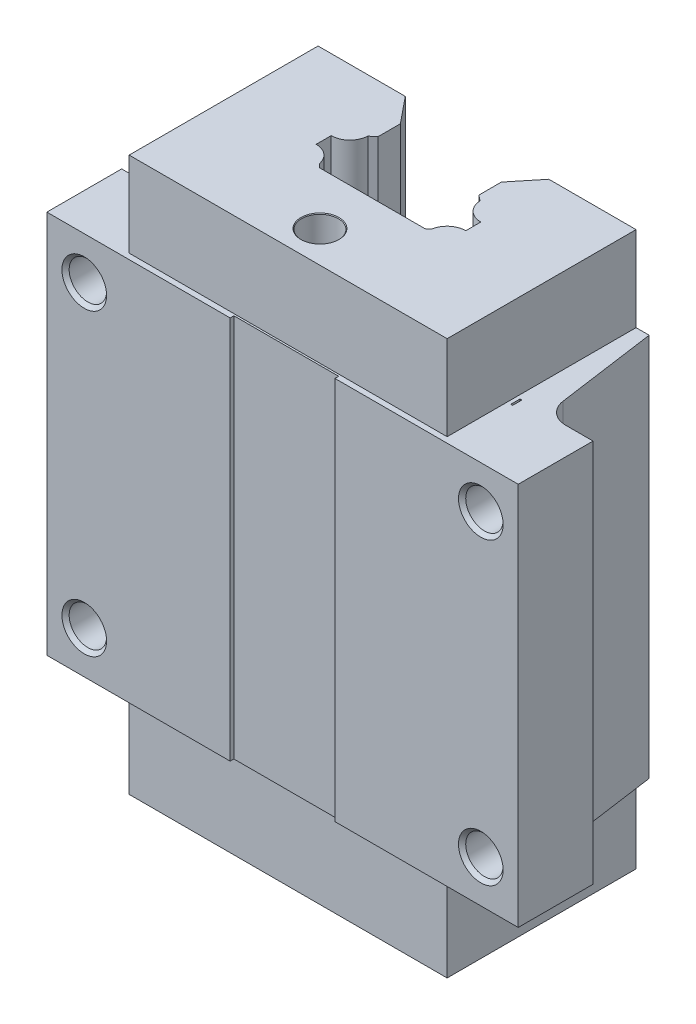
from build123d import *

# Parameters (mm, degrees)
SKIZZE1_W                       = 44
SKIZZE1_H                       = 51.3
AUFSATZ_LINEAR_AUSTRAGEN1_DEPTH = 26
SKIZZE2_W                       = 0.25
SKIZZE2_H                       = 17.25
SCHNITT_LINEAR_AUSTRAGEN1_DEPTH = 64.369472146
SKIZZE3_W                       = 14
SKIZZE3_H                       = 0.5
SCHNITT_LINEAR_AUSTRAGEN2_DEPTH = 64.369472146
SKIZZE4_W                       = 0.25
SKIZZE4_H                       = 17.25
SCHNITT_LINEAR_AUSTRAGEN3_DEPTH = 51.3
SKIZZE5_W                       = 42.5
SKIZZE5_H                       = 25.25
AUFSATZ_LINEAR_AUSTRAGEN2_DEPTH = 11.35
SKIZZE6_W                       = 42.5
SKIZZE6_H                       = 25.25
AUFSATZ_LINEAR_AUSTRAGEN3_DEPTH = 11.35
SKIZZE15_W                      = 9.5
SKIZZE15_H                      = 51.3
AUFSATZ_LINEAR_AUSTRAGEN5_DEPTH = 10
SCHNITT_LINEAR_AUSTRAGEN4_DEPTH = 86.838511171
BOHRUNG1_D                      = 4.917
BOHRUNG1_DEPTH                  = 15
BOHRUNG1_TIP                    = 1.477215832
BOHRUNG2_D                      = 4.917
BOHRUNG2_DEPTH                  = 15
BOHRUNG2_TIP                    = 1.477215832
M6_GEWINDEBOHRUNG1_D            = 5
M6_GEWINDEBOHRUNG1_DEPTH        = 17
M6_GEWINDEBOHRUNG1_TIP          = 1.502151548
FASE1_SIZE                      = 0.483
FASE2_SIZE                      = 0.448979592
FASE3_SIZE                      = 0.0915
FASE4_SIZE                      = 0.448979592
AUFSATZ_LINEAR_START            = -51.3
AUFSATZ_LINEAR_AUSTRAGEN6_DEPTH = 51.3
VERRUNDUNG1_R                   = 3


with BuildPart() as part:
    # Skizze1 → Aufsatz-Linear austragen1 (new body)
    with BuildSketch(Plane(origin=(0, 0, 4), x_dir=(-1, 0, 0), z_dir=(0, 0, -1))):
        Rectangle(SKIZZE1_W, SKIZZE1_H)
    extrude(amount=-AUFSATZ_LINEAR_AUSTRAGEN1_DEPTH)

    # Skizze2 → Schnitt-Linear austragen1 (cut, through all)
    with BuildSketch(Plane.XZ.offset(25.65)):
        with Locations((-21.875, 12.625)):
            Rectangle(SKIZZE2_W, SKIZZE2_H)
    extrude(amount=-SCHNITT_LINEAR_AUSTRAGEN1_DEPTH, mode=Mode.SUBTRACT)

    # Skizze3 → Schnitt-Linear austragen2 (cut, through all)
    with BuildSketch(Plane.XZ.offset(25.65)):
        with Locations((0, 29.75)):
            Rectangle(SKIZZE3_W, SKIZZE3_H)
    extrude(amount=-SCHNITT_LINEAR_AUSTRAGEN2_DEPTH, mode=Mode.SUBTRACT)

    # Skizze4 → Schnitt-Linear austragen3 (cut)
    with BuildSketch(Plane.XZ.offset(25.65)):
        with Locations((21.875, 12.625)):
            Rectangle(SKIZZE4_W, SKIZZE4_H)
    extrude(amount=-SCHNITT_LINEAR_AUSTRAGEN3_DEPTH, mode=Mode.SUBTRACT)

    # Skizze5 → Aufsatz-Linear austragen2 (add)
    with BuildSketch(Plane(origin=(0, 25.65, 0), x_dir=(-1, 0, 0), z_dir=(0, 1, 0))):
        with Locations((0, 16.625)):
            Rectangle(SKIZZE5_W, SKIZZE5_H)
    extrude(amount=AUFSATZ_LINEAR_AUSTRAGEN2_DEPTH)

    # Skizze6 → Aufsatz-Linear austragen3 (add)
    with BuildSketch(Plane.XZ.offset(25.65)):
        with Locations((0, 16.625)):
            Rectangle(SKIZZE6_W, SKIZZE6_H)
    extrude(amount=AUFSATZ_LINEAR_AUSTRAGEN3_DEPTH)

    # Skizze15 → Aufsatz-Linear austragen5 (add)
    with BuildSketch(Plane.XY.offset(30)):
        with Locations((-26.75, 0)):
            Rectangle(SKIZZE15_W, SKIZZE15_H)
        with Locations((26.75, 0)):
            Rectangle(SKIZZE15_W, SKIZZE15_H)
    extrude(amount=-AUFSATZ_LINEAR_AUSTRAGEN5_DEPTH)

    # Skizze7 → Schnitt-Linear austragen4 (cut, through all)
    with BuildSketch(Plane.XZ.offset(37)):
        with BuildLine():
            Line((-9.59375, 4), (9.59375, 4))
            Line((9.59375, 4), (6.75, 7.5))
            Line((6.75, 7.5), (6.75, 10.5))
            Line((6.75, 10.5), (7.5, 11.109375))
            ThreePointArc((7.5, 11.109375), (8.270470592, 12.806156162), (10, 13.5))
            Line((10, 13.5), (10, 15.5))
            ThreePointArc((10, 15.5), (8.232233047, 16.232233047), (7.5, 18))
            Line((7.5, 18), (-7.5, 18))
            ThreePointArc((-7.5, 18), (-8.232233047, 16.232233047), (-10, 15.5))
            Line((-10, 15.5), (-10, 13.5))
            ThreePointArc((-10, 13.5), (-8.270470592, 12.806156162), (-7.5, 11.109375))
            Line((-7.5, 11.109375), (-6.75, 10.5))
            Line((-6.75, 10.5), (-6.75, 7.5))
            Line((-6.75, 7.5), (-9.59375, 4))
        make_face()
    extrude(amount=-SCHNITT_LINEAR_AUSTRAGEN4_DEPTH, mode=Mode.SUBTRACT)

    # Bohrung1
    with Locations(Plane(origin=(0, -37, 0), x_dir=(-1, 0, 0), z_dir=(0, -1, 0))):
        with Locations((0, -25)):
            Hole(BOHRUNG1_D / 2, depth=BOHRUNG1_DEPTH)
            with Locations((0, 0, -(BOHRUNG1_DEPTH + BOHRUNG1_TIP / 2))):  # 118° drill point
                Cone(0, BOHRUNG1_D / 2, BOHRUNG1_TIP, mode=Mode.SUBTRACT)

    # Bohrung2
    with Locations(Plane(origin=(0, 37, 0), x_dir=(1, 0, 0), z_dir=(0, 1, 0))):
        with Locations((0, -25)):
            Hole(BOHRUNG2_D / 2, depth=BOHRUNG2_DEPTH)
            with Locations((0, 0, -(BOHRUNG2_DEPTH + BOHRUNG2_TIP / 2))):  # 118° drill point
                Cone(0, BOHRUNG2_D / 2, BOHRUNG2_TIP, mode=Mode.SUBTRACT)

    # M6 Gewindebohrung1
    with Locations(Plane.XY.offset(30)):
        with Locations((26.5, -20), (26.5, 20), (-26.5, 20), (-26.5, -20)):
            Hole(M6_GEWINDEBOHRUNG1_D / 2, depth=M6_GEWINDEBOHRUNG1_DEPTH)
            with Locations((0, 0, -(M6_GEWINDEBOHRUNG1_DEPTH + M6_GEWINDEBOHRUNG1_TIP / 2))):  # 118° drill point
                Cone(0, M6_GEWINDEBOHRUNG1_D / 2, M6_GEWINDEBOHRUNG1_TIP, mode=Mode.SUBTRACT)

    # Fase1
    fase1_edges = [part.edges().sort_by_distance(p)[0] for p in [
        (-24, -20, 30),
        (-24, 20, 30),
        (29, 20, 30),
        (29, -20, 30),
    ]]
    chamfer(fase1_edges, length=FASE1_SIZE)

    # Fase2
    # the kernel refuses this chamfer: 0.448979592, 0.406117321 mm, written as the material it adds along each edge
    with BuildSketch(Plane(origin=(-7.5, -37, 18), x_dir=(1, 0, 0), z_dir=(0, 1, 0))) as fase2_piece_1:
        with BuildLine():
            Line((FASE2_SIZE, 0), (-0.03932739, 0.441690284))
            ThreePointArc((-0.03932739, 0.441690284), (-0.010448273, 0.22832477), (0, 0))
            Line((0, 0), (FASE2_SIZE, 0))
        make_face()
    extrude(amount=74)

    # Fase3
    fase3_edges = [part.edges().sort_by_distance(p)[0] for p in [
        (-2.4585, -37, 25),
        (2.4585, 37, 25),
    ]]
    chamfer(fase3_edges, length=FASE3_SIZE)

    # Fase4
    # the kernel refuses this chamfer: 0.448979592, 0.406117321 mm, written as the material it adds along each edge
    with BuildSketch(Plane(origin=(7.5, -37, 18), x_dir=(0.08868753028202897, 0, -0.9960594972050988), z_dir=(0, 1, 0))) as fase4_piece_1:
        with BuildLine():
            Line((0.443437651, 0), (-FASE4_SIZE * 0.0886875302498, FASE4_SIZE * 0.996059496843))
            Line((-FASE4_SIZE * 0.0886875302498, FASE4_SIZE * 0.996059496843), (0, 0))
            ThreePointArc((0, 0), (0.228351687, 0.009842458), (0.443437651, 0))
        make_face()
    extrude(amount=74)

    # Skizze16 → Aufsatz-Linear austragen6 (add)
    with BuildSketch(Plane.XZ.offset(25.65).offset(AUFSATZ_LINEAR_START)):
        Polygon((-21.75, 4), (-21.75, 20), (-25.25, 20), (-23, 4), align=None)
        Polygon((21.75, 20), (25.25, 20), (23, 4), (21.75, 4), align=None)
    extrude(amount=AUFSATZ_LINEAR_AUSTRAGEN6_DEPTH)

    # Verrundung1
    # the kernel refuses this fillet: 3 mm, written as the material it adds along each edge
    with BuildSketch(Plane(origin=(-25.25, 25.65, 20), x_dir=(0.13925483139909986, 0, -0.9902565788380344), z_dir=(0, -1, 0))) as verrundung1_piece_1_section:
        with BuildLine():
            CenterArc((VERRUNDUNG1_R * 0.869214289504, -VERRUNDUNG1_R), VERRUNDUNG1_R, 90, 81.995271143)
            Line((-VERRUNDUNG1_R * 0.121042289335, -VERRUNDUNG1_R * 0.860745168601), (0, 0))
            Line((0, 0), (VERRUNDUNG1_R * 0.869214289504, 0))
        make_face()
    verrundung1_piece_1 = extrude(amount=10.004043662, mode=Mode.PRIVATE)
    verrundung1_piece_1 = verrundung1_piece_1 - Plane(origin=(-26.5, 20, 20), x_dir=(-1, 0, 0), z_dir=(0, 0, -1)) * Cylinder(2.5, 31, mode=Mode.PRIVATE)
    add(verrundung1_piece_1)
    with BuildSketch(Plane(origin=(-25.25, 24.354043662, 20), x_dir=(0.13925483139909986, 0, -0.9902565788380344), z_dir=(0, -1, 0))) as verrundung1_piece_2_section:
        with BuildLine():
            CenterArc((VERRUNDUNG1_R * 0.869214289504, -VERRUNDUNG1_R), VERRUNDUNG1_R, 90, 81.995271143)
            Line((-VERRUNDUNG1_R * 0.121042289335, -VERRUNDUNG1_R * 0.860745168601), (0, 0))
            Line((0, 0), (VERRUNDUNG1_R * 0.869214289504, 0))
        make_face()
    verrundung1_piece_2 = extrude(amount=48.708087324, mode=Mode.PRIVATE)
    verrundung1_piece_2 = verrundung1_piece_2 - Plane(origin=(-26.5, -20, 20), x_dir=(-1, 0, 0), z_dir=(0, 0, -1)) * Cylinder(2.5, 108, mode=Mode.PRIVATE)
    verrundung1_piece_2 = verrundung1_piece_2 - Plane(origin=(-26.5, 20, 20), x_dir=(-1, 0, 0), z_dir=(0, 0, -1)) * Cylinder(2.5, 108, mode=Mode.PRIVATE)
    add(verrundung1_piece_2)
    with BuildSketch(Plane(origin=(-25.25, -15.645956338, 20), x_dir=(0.13925483139909986, 0, -0.9902565788380344), z_dir=(0, -1, 0))) as verrundung1_piece_3_section:
        with BuildLine():
            CenterArc((VERRUNDUNG1_R * 0.869214289504, -VERRUNDUNG1_R), VERRUNDUNG1_R, 90, 81.995271143)
            Line((-VERRUNDUNG1_R * 0.121042289335, -VERRUNDUNG1_R * 0.860745168601), (0, 0))
            Line((0, 0), (VERRUNDUNG1_R * 0.869214289504, 0))
        make_face()
    verrundung1_piece_3 = extrude(amount=10.004043662, mode=Mode.PRIVATE)
    verrundung1_piece_3 = verrundung1_piece_3 - Plane(origin=(-26.5, -20, 20), x_dir=(-1, 0, 0), z_dir=(0, 0, -1)) * Cylinder(2.5, 31, mode=Mode.PRIVATE)
    add(verrundung1_piece_3)
    with BuildSketch(Plane(origin=(25.25, 25.65, 20), x_dir=(1, 0, 0), z_dir=(0, -1, 0))) as verrundung1_piece_4_section:
        with BuildLine():
            CenterArc((VERRUNDUNG1_R * 0.869214289504, -VERRUNDUNG1_R), VERRUNDUNG1_R, 90, 81.995271143)
            Line((-VERRUNDUNG1_R * 0.121042289335, -VERRUNDUNG1_R * 0.860745168601), (0, 0))
            Line((0, 0), (VERRUNDUNG1_R * 0.869214289504, 0))
        make_face()
    verrundung1_piece_4 = extrude(amount=10.004043662, mode=Mode.PRIVATE)
    verrundung1_piece_4 = verrundung1_piece_4 - Plane(origin=(26.5, 20, 20), x_dir=(-1, 0, 0), z_dir=(0, 0, -1)) * Cylinder(2.5, 31, mode=Mode.PRIVATE)
    add(verrundung1_piece_4)
    with BuildSketch(Plane(origin=(25.25, 24.354043662, 20), x_dir=(1, 0, 0), z_dir=(0, -1, 0))) as verrundung1_piece_5_section:
        with BuildLine():
            CenterArc((VERRUNDUNG1_R * 0.869214289504, -VERRUNDUNG1_R), VERRUNDUNG1_R, 90, 81.995271143)
            Line((-VERRUNDUNG1_R * 0.121042289335, -VERRUNDUNG1_R * 0.860745168601), (0, 0))
            Line((0, 0), (VERRUNDUNG1_R * 0.869214289504, 0))
        make_face()
    verrundung1_piece_5 = extrude(amount=48.708087324, mode=Mode.PRIVATE)
    verrundung1_piece_5 = verrundung1_piece_5 - Plane(origin=(26.5, -20, 20), x_dir=(-1, 0, 0), z_dir=(0, 0, -1)) * Cylinder(2.5, 108, mode=Mode.PRIVATE)
    verrundung1_piece_5 = verrundung1_piece_5 - Plane(origin=(26.5, 20, 20), x_dir=(-1, 0, 0), z_dir=(0, 0, -1)) * Cylinder(2.5, 108, mode=Mode.PRIVATE)
    add(verrundung1_piece_5)
    with BuildSketch(Plane(origin=(25.25, -15.645956338, 20), x_dir=(1, 0, 0), z_dir=(0, -1, 0))) as verrundung1_piece_6_section:
        with BuildLine():
            CenterArc((VERRUNDUNG1_R * 0.869214289504, -VERRUNDUNG1_R), VERRUNDUNG1_R, 90, 81.995271143)
            Line((-VERRUNDUNG1_R * 0.121042289335, -VERRUNDUNG1_R * 0.860745168601), (0, 0))
            Line((0, 0), (VERRUNDUNG1_R * 0.869214289504, 0))
        make_face()
    verrundung1_piece_6 = extrude(amount=10.004043662, mode=Mode.PRIVATE)
    verrundung1_piece_6 = verrundung1_piece_6 - Plane(origin=(26.5, -20, 20), x_dir=(-1, 0, 0), z_dir=(0, 0, -1)) * Cylinder(2.5, 31, mode=Mode.PRIVATE)
    add(verrundung1_piece_6)


solid = part.part
